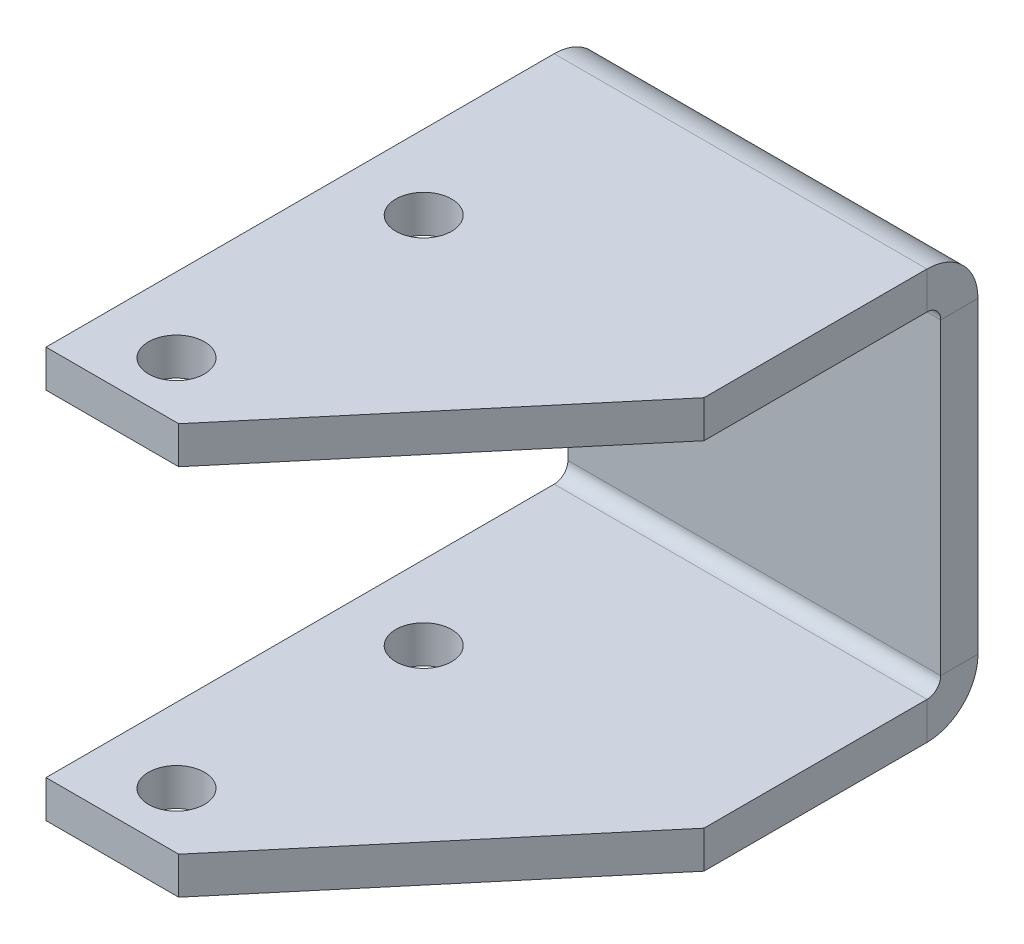
from build123d import *

# Parameters (mm, degrees)
SCHIZZO1_W                       = 20
SCHIZZO1_H                       = 18
BASE_FLANGIA1_DEPTH              = 2
BORDO_FLANGIA3_STRIP_W           = 9.4732
BORDO_FLANGIA3_STRIP_H           = 2
BORDO_FLANGIA3_STRIP_CUT_DEPTH   = 20
BORDO_FLANGIA3_STRIP_2_W         = 9.4732
BORDO_FLANGIA3_STRIP_2_H         = 2
BORDO_FLANGIA3_STRIP_CUT_2_DEPTH = 20
BORDO_FLANGIA3_DEPTH             = 20
BORDO_FLANGIA3_BEND_DEPTH        = 20
TAGLIO_ESTRUSIONE1_DEPTH         = 41.841155713
TAGLIO_ESTRUSIONE1_DEPTH_BACK    = 41.841155713
TAGLIO_ESTRUSIONE2_DEPTH         = 41.841155713
TAGLIO_ESTRUSIONE2_DEPTH_BACK    = 41.841155713
SCHIZZO20_R                      = 1.5


# Sheet-metal steps are written as plain solids
with BuildPart() as part:
    # Schizzo1 → Base-Flangia1 (new body)
    with BuildSketch(Plane.XY):
        with Locations((10, 9)):
            Rectangle(SCHIZZO1_W, SCHIZZO1_H)
    extrude(amount=-BASE_FLANGIA1_DEPTH)

    # Bordo-Flangia3 strip (across the edge) → Bordo-Flangia3 strip cut (cut)
    with BuildSketch(Plane(origin=(20, 18, 0), x_dir=(0, -1, 0), z_dir=(-1, 0, 0))):
        with Locations((-4, -1)):
            Rectangle(BORDO_FLANGIA3_STRIP_W, BORDO_FLANGIA3_STRIP_H)
    extrude(amount=BORDO_FLANGIA3_STRIP_CUT_DEPTH, mode=Mode.SUBTRACT)

    # Bordo-Flangia3 strip 2 (across the edge) → Bordo-Flangia3 strip cut 2 (cut)
    with BuildSketch(Plane.YZ):
        with Locations((-4, -1)):
            Rectangle(BORDO_FLANGIA3_STRIP_2_W, BORDO_FLANGIA3_STRIP_2_H)
    extrude(amount=BORDO_FLANGIA3_STRIP_CUT_2_DEPTH, mode=Mode.SUBTRACT)

    # Bordo-Flangia3 section (across the edge) → Bordo-Flangia3 (add)
    with BuildSketch(Plane(origin=(20, 18, 0), x_dir=(0, -1, 0), z_dir=(-1, 0, 0))):
        with BuildLine():
            Line((-2, 0.7366), (-2, 28))
            Line((-2, 28), (0, 28))
            Line((0, 28), (0, 0.7366))
            ThreePointArc((0, 0.7366), (0.215745145, 0.215745145), (0.7366, 0))
            Line((0.7366, 0), (0.7366, -2))
            ThreePointArc((0.7366, -2), (-1.198468417, -1.198468417), (-2, 0.7366))
        make_face()
    extrude(amount=BORDO_FLANGIA3_DEPTH)

    # Bordo-Flangia3 section 2 (across the edge) → Bordo-Flangia3 bend (add)
    with BuildSketch(Plane.YZ):
        with BuildLine():
            Line((-2, 0.7366), (-2, 28))
            Line((-2, 28), (0, 28))
            Line((0, 28), (0, 0.7366))
            ThreePointArc((0, 0.7366), (0.215745145, 0.215745145), (0.7366, 0))
            Line((0.7366, 0), (0.7366, -2))
            ThreePointArc((0.7366, -2), (-1.198468417, -1.198468417), (-2, 0.7366))
        make_face()
    extrude(amount=BORDO_FLANGIA3_BEND_DEPTH)

    # Schizzo19 → Taglio-Estrusione1 (cut, two sides: drawn at the far end of the back side and taken through both)
    with BuildSketch(Plane.XZ.offset(2).offset(-TAGLIO_ESTRUSIONE1_DEPTH_BACK)):
        Polygon((7.119394424, 28), (20, 12.7), (20, 28), align=None)
    extrude(amount=TAGLIO_ESTRUSIONE1_DEPTH + TAGLIO_ESTRUSIONE1_DEPTH_BACK, mode=Mode.SUBTRACT)

    # Schizzo20 → Taglio-Estrusione2 (cut, two sides: drawn at the far end of the back side and taken through both)
    with BuildSketch(Plane(origin=(0, 20, 0), x_dir=(1, 0, 0), z_dir=(0, 1, 0)).offset(-TAGLIO_ESTRUSIONE2_DEPTH_BACK)):
        with Locations(Location((4, -11.7366, 0), (0, 0, 270))):
            Circle(SCHIZZO20_R)
        with Locations(Location((4, -25, 0), (0, 0, 270))):
            Circle(SCHIZZO20_R)
    extrude(amount=TAGLIO_ESTRUSIONE2_DEPTH + TAGLIO_ESTRUSIONE2_DEPTH_BACK, mode=Mode.SUBTRACT)


solid = part.part
